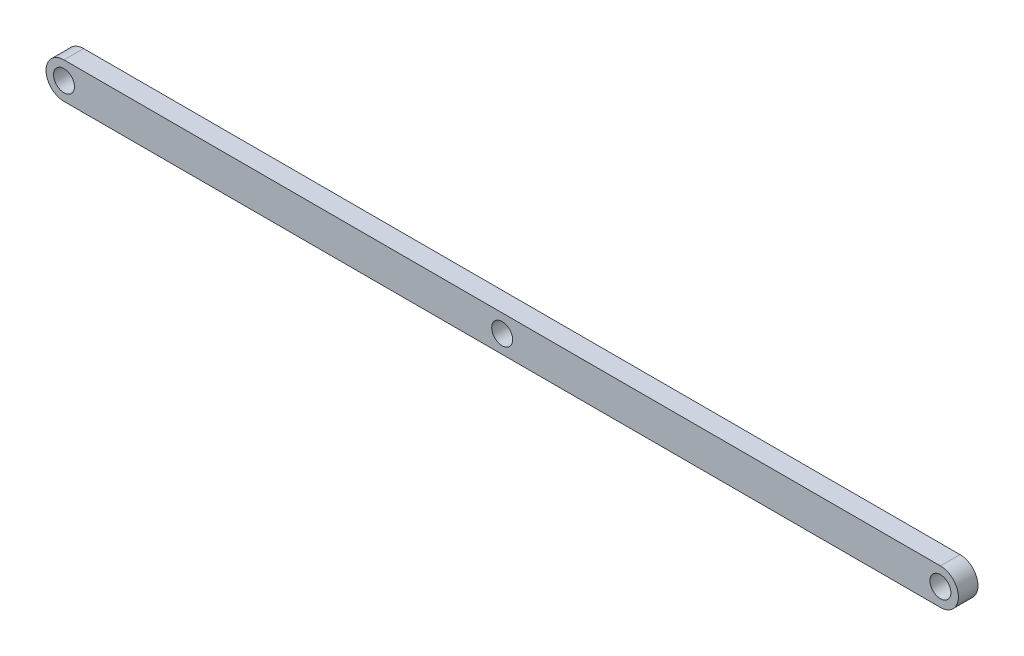
from build123d import *

# Parameters (mm, degrees)
SKETCH_1_R      = 1.6
EXTRUDE_1_DEPTH = 3


with BuildPart() as part:
    # 草圖1 → 填料-伸長1 (new body)
    with BuildSketch(Plane.XY):
        with BuildLine():
            Line((-41.926380368, 2.75), (92.073619632, 2.75))
            ThreePointArc((92.073619632, 2.75), (94.823619632, 0), (92.073619632, -2.75))
            Line((92.073619632, -2.75), (-41.926380368, -2.75))
            ThreePointArc((-41.926380368, -2.75), (-44.676380368, 0), (-41.926380368, 2.75))
        make_face()
        with Locations((92.073619632, 0)):
            Circle(SKETCH_1_R, mode=Mode.SUBTRACT)
        with Locations((-41.926380368, 0)):
            Circle(SKETCH_1_R, mode=Mode.SUBTRACT)
        with Locations((25.073619632, 0)):
            Circle(SKETCH_1_R, mode=Mode.SUBTRACT)
    extrude(amount=EXTRUDE_1_DEPTH)


solid = part.part
